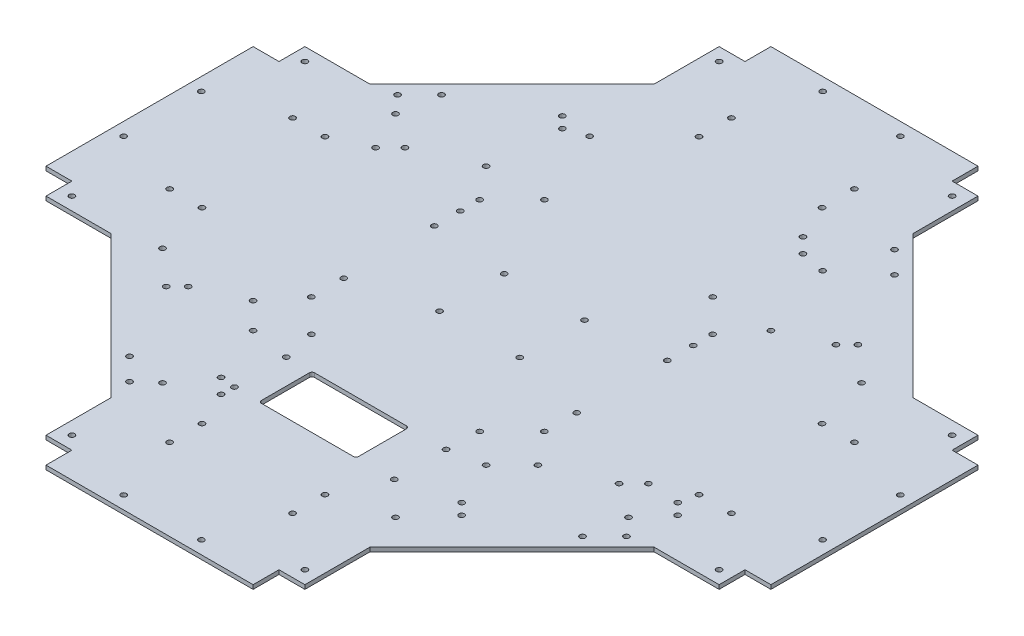
from build123d import *

# Parameters (mm, degrees)
SKETCH1_R           = 2.125
BOSS_EXTRUDE1_DEPTH = 3.175
SKETCH2_R           = 2.125
SKETCH2_W           = 75
SKETCH2_H           = 41
CUT_EXTRUDE1_DEPTH  = 396.992525971
FILLET1_R           = 2
SKETCH3_W           = 20
SKETCH3_H           = 20
CUT_EXTRUDE2_DEPTH  = 396.992525971


with BuildPart() as part:
    # Sketch1 → Boss-Extrude1 (new body)
    with BuildSketch(Plane(origin=(0, 0, 0), x_dir=(1, 0, 0), z_dir=(0, 1, 0))):
        Polygon((-100, -280), (0, -280), (100, -280), (100, -209.601551084), (209.601551084, -100), (280, -100), (280, 0), (280, 100), (209.601551084, 100), (100, 209.601551084), (100, 280), (0, 280), (-100, 280), (-100, 209.601551084), (-209.601551084, 100), (-280, 100), (-280, 0), (-280, -100), (-209.601551084, -100), (-100, -209.601551084), align=None)
        with Locations((-90, -270)):
            Circle(SKETCH1_R, mode=Mode.SUBTRACT)
        with Locations((-90, -250)):
            Circle(SKETCH1_R, mode=Mode.SUBTRACT)
        with Locations((-30, -270)):
            Circle(SKETCH1_R, mode=Mode.SUBTRACT)
        with Locations((-47.5, -217)):
            Circle(SKETCH1_R, mode=Mode.SUBTRACT)
        with Locations((-90, -180)):
            Circle(SKETCH1_R, mode=Mode.SUBTRACT)
        with Locations((-47.5, -192)):
            Circle(SKETCH1_R, mode=Mode.SUBTRACT)
        with Locations((-270, -90)):
            Circle(SKETCH1_R, mode=Mode.SUBTRACT)
        with Locations((-250, -90)):
            Circle(SKETCH1_R, mode=Mode.SUBTRACT)
        with Locations((-180, -90)):
            Circle(SKETCH1_R, mode=Mode.SUBTRACT)
        with Locations((-217, -47.5)):
            Circle(SKETCH1_R, mode=Mode.SUBTRACT)
        with Locations((-270, -30)):
            Circle(SKETCH1_R, mode=Mode.SUBTRACT)
        with Locations((-192, -47.5)):
            Circle(SKETCH1_R, mode=Mode.SUBTRACT)
        with Locations((-90, -110)):
            Circle(SKETCH1_R, mode=Mode.SUBTRACT)
        with Locations((-110, -90)):
            Circle(SKETCH1_R, mode=Mode.SUBTRACT)
        with Locations((-90, -40)):
            Circle(SKETCH1_R, mode=Mode.SUBTRACT)
        with Locations((30, -270)):
            Circle(SKETCH1_R, mode=Mode.SUBTRACT)
        with Locations((47.5, -217)):
            Circle(SKETCH1_R, mode=Mode.SUBTRACT)
        with Locations((90, -270)):
            Circle(SKETCH1_R, mode=Mode.SUBTRACT)
        with Locations((90, -250)):
            Circle(SKETCH1_R, mode=Mode.SUBTRACT)
        with Locations((47.5, -192)):
            Circle(SKETCH1_R, mode=Mode.SUBTRACT)
        with Locations((90, -180)):
            Circle(SKETCH1_R, mode=Mode.SUBTRACT)
        with Locations((90, -110)):
            Circle(SKETCH1_R, mode=Mode.SUBTRACT)
        with Locations((110, -90)):
            Circle(SKETCH1_R, mode=Mode.SUBTRACT)
        with Locations((90, -40)):
            Circle(SKETCH1_R, mode=Mode.SUBTRACT)
        with Locations((180, -90)):
            Circle(SKETCH1_R, mode=Mode.SUBTRACT)
        with Locations((250, -90)):
            Circle(SKETCH1_R, mode=Mode.SUBTRACT)
        with Locations((270, -90)):
            Circle(SKETCH1_R, mode=Mode.SUBTRACT)
        with Locations((192, -47.5)):
            Circle(SKETCH1_R, mode=Mode.SUBTRACT)
        with Locations((217, -47.5)):
            Circle(SKETCH1_R, mode=Mode.SUBTRACT)
        with Locations((270, -30)):
            Circle(SKETCH1_R, mode=Mode.SUBTRACT)
        with Locations((-270, 30)):
            Circle(SKETCH1_R, mode=Mode.SUBTRACT)
        with Locations((-217, 47.5)):
            Circle(SKETCH1_R, mode=Mode.SUBTRACT)
        with Locations((-192, 47.5)):
            Circle(SKETCH1_R, mode=Mode.SUBTRACT)
        with Locations((-270, 90)):
            Circle(SKETCH1_R, mode=Mode.SUBTRACT)
        with Locations((-250, 90)):
            Circle(SKETCH1_R, mode=Mode.SUBTRACT)
        with Locations((-180, 90)):
            Circle(SKETCH1_R, mode=Mode.SUBTRACT)
        with Locations((-90, 30)):
            Circle(SKETCH1_R, mode=Mode.SUBTRACT)
        with Locations((-90, 50)):
            Circle(SKETCH1_R, mode=Mode.SUBTRACT)
        with Locations((-110, 90)):
            Circle(SKETCH1_R, mode=Mode.SUBTRACT)
        with Locations((-90, 150)):
            Circle(SKETCH1_R, mode=Mode.SUBTRACT)
        with Locations((-47.5, 192)):
            Circle(SKETCH1_R, mode=Mode.SUBTRACT)
        with Locations((-90, 250)):
            Circle(SKETCH1_R, mode=Mode.SUBTRACT)
        with Locations((-90, 270)):
            Circle(SKETCH1_R, mode=Mode.SUBTRACT)
        with Locations((-47.5, 217)):
            Circle(SKETCH1_R, mode=Mode.SUBTRACT)
        with Locations((-30, 270)):
            Circle(SKETCH1_R, mode=Mode.SUBTRACT)
        with Locations((90, 30)):
            Circle(SKETCH1_R, mode=Mode.SUBTRACT)
        with Locations((90, 50)):
            Circle(SKETCH1_R, mode=Mode.SUBTRACT)
        with Locations((110, 90)):
            Circle(SKETCH1_R, mode=Mode.SUBTRACT)
        with Locations((192, 47.5)):
            Circle(SKETCH1_R, mode=Mode.SUBTRACT)
        with Locations((270, 30)):
            Circle(SKETCH1_R, mode=Mode.SUBTRACT)
        with Locations((217, 47.5)):
            Circle(SKETCH1_R, mode=Mode.SUBTRACT)
        with Locations((180, 90)):
            Circle(SKETCH1_R, mode=Mode.SUBTRACT)
        with Locations((250, 90)):
            Circle(SKETCH1_R, mode=Mode.SUBTRACT)
        with Locations((270, 90)):
            Circle(SKETCH1_R, mode=Mode.SUBTRACT)
        with Locations((47.5, 192)):
            Circle(SKETCH1_R, mode=Mode.SUBTRACT)
        with Locations((90, 150)):
            Circle(SKETCH1_R, mode=Mode.SUBTRACT)
        with Locations((47.5, 217)):
            Circle(SKETCH1_R, mode=Mode.SUBTRACT)
        with Locations((30, 270)):
            Circle(SKETCH1_R, mode=Mode.SUBTRACT)
        with Locations((90, 250)):
            Circle(SKETCH1_R, mode=Mode.SUBTRACT)
        with Locations((90, 270)):
            Circle(SKETCH1_R, mode=Mode.SUBTRACT)
    extrude(amount=BOSS_EXTRUDE1_DEPTH)

    # Sketch2 → Cut-Extrude1 (cut, through all)
    with BuildSketch(Plane(origin=(0, 3.175, 0), x_dir=(1, 0, 0), z_dir=(0, 1, 0))):
        with Locations((-31, 25)):
            Circle(SKETCH2_R)
        with Locations((-31, -25)):
            Circle(SKETCH2_R)
        with Locations((31, -25)):
            Circle(SKETCH2_R)
        with Locations((31, 25)):
            Circle(SKETCH2_R)
        with Locations((-90, 65)):
            Circle(SKETCH2_R)
        with Locations((-65, 90)):
            Circle(SKETCH2_R)
        with Locations((65, 90)):
            Circle(SKETCH2_R)
        with Locations((90, 65)):
            Circle(SKETCH2_R)
        with Locations((90, -65)):
            Circle(SKETCH2_R)
        with Locations((65, -90)):
            Circle(SKETCH2_R)
        with Locations((-65, -90)):
            Circle(SKETCH2_R)
        with Locations((-90, -65)):
            Circle(SKETCH2_R)
        with Locations((64.065141092, -115)):
            Circle(SKETCH2_R)
        with Locations((64.065141092, -155)):
            Circle(SKETCH2_R)
        with Locations((-59.434858908, -115)):
            Circle(SKETCH2_R)
        with Locations((-59.434858908, -155)):
            Circle(SKETCH2_R)
        with Locations((174.953318806, -120.506096654)):
            Circle(SKETCH2_R)
        with Locations((191.923881554, -103.535533906)):
            Circle(SKETCH2_R)
        with Locations((153.736977236, -71.011760106)):
            Circle(SKETCH2_R)
        with Locations((165.050685735, -59.698051607)):
            Circle(SKETCH2_R)
        with Locations((-71.011760106, -153.736977236)):
            Circle(SKETCH2_R)
        with Locations((-59.698051607, -165.050685735)):
            Circle(SKETCH2_R)
        with Locations((-120.506096654, -174.953318806)):
            Circle(SKETCH2_R)
        with Locations((-103.535533906, -191.923881554)):
            Circle(SKETCH2_R)
        with Locations((-153.736977236, 71.011760106)):
            Circle(SKETCH2_R)
        with Locations((-165.050685735, 59.698051607)):
            Circle(SKETCH2_R)
        with Locations((-174.953318806, 120.506096654)):
            Circle(SKETCH2_R)
        with Locations((-191.923881554, 103.535533906)):
            Circle(SKETCH2_R)
        with Locations((71.011760106, 153.736977236)):
            Circle(SKETCH2_R)
        with Locations((59.698051607, 165.050685735)):
            Circle(SKETCH2_R)
        with Locations((120.506096654, 174.953318806)):
            Circle(SKETCH2_R)
        with Locations((103.535533906, 191.923881554)):
            Circle(SKETCH2_R)
        with Locations((114.142135624, -153.033008589)):
            Circle(SKETCH2_R)
        with Locations((105.656854249, -144.547727215)):
            Circle(SKETCH2_R)
        with Locations((-144.547727215, -105.656854249)):
            Circle(SKETCH2_R)
        with Locations((-153.033008589, -114.142135624)):
            Circle(SKETCH2_R)
        with Locations((-105.656854249, 144.547727215)):
            Circle(SKETCH2_R)
        with Locations((-114.142135624, 153.033008589)):
            Circle(SKETCH2_R)
        with Locations((144.547727215, 105.656854249)):
            Circle(SKETCH2_R)
        with Locations((153.033008589, 114.142135624)):
            Circle(SKETCH2_R)
        with Locations((197.580735804, -69.594408409)):
            Circle(SKETCH2_R)
        with Locations((189.09545443, -61.109127035)):
            Circle(SKETCH2_R)
        with Locations((-2.534858908, -135)):
            Rectangle(SKETCH2_W, SKETCH2_H)
    extrude(amount=-CUT_EXTRUDE1_DEPTH, mode=Mode.SUBTRACT)

    # Fillet1
    fillet1_edges = [part.edges().sort_by_distance(p)[0] for p in [
        (34.965141092, 1.5875, 114.5),
        (34.965141092, 1.5875, 155.5),
        (-40.034858908, 1.5875, 155.5),
        (-40.034858908, 1.5875, 114.5),
    ]]
    fillet(fillet1_edges, radius=FILLET1_R)

    # Sketch3 → Cut-Extrude2 (cut, through all)
    with BuildSketch(Plane(origin=(0, 3.175, 0), x_dir=(1, 0, 0), z_dir=(0, 1, 0))):
        with Locations((90, -270)):
            Rectangle(SKETCH3_W, SKETCH3_H)
        with Locations((-90, -270)):
            Rectangle(SKETCH3_W, SKETCH3_H)
        with Locations((-270, 90)):
            Rectangle(SKETCH3_W, SKETCH3_H)
        with Locations((-270, -90)):
            Rectangle(SKETCH3_W, SKETCH3_H)
        with Locations((90, 270)):
            Rectangle(SKETCH3_W, SKETCH3_H)
        with Locations((-90, 270)):
            Rectangle(SKETCH3_W, SKETCH3_H)
        with Locations((270, -90)):
            Rectangle(SKETCH3_W, SKETCH3_H)
        with Locations((270, 90)):
            Rectangle(SKETCH3_W, SKETCH3_H)
    extrude(amount=-CUT_EXTRUDE2_DEPTH, mode=Mode.SUBTRACT)


solid = part.part
